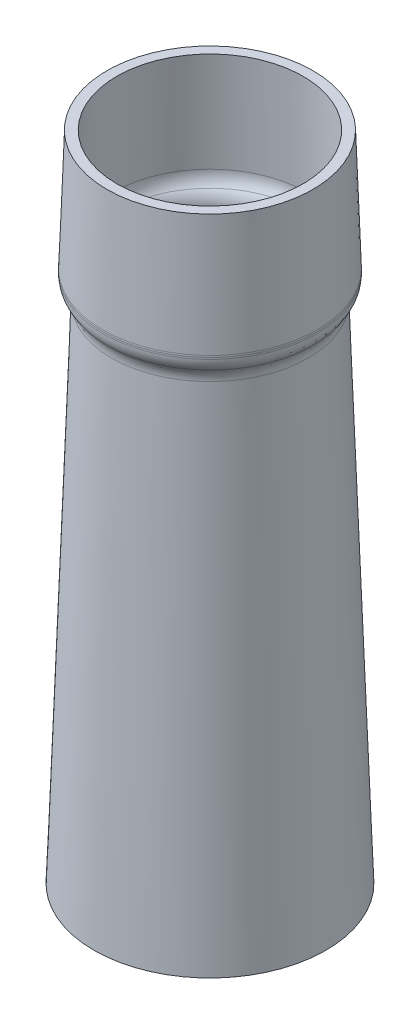
from build123d import *

# Parameters (mm, degrees)
SKETCH1_R                = 4.755
BOSS_EXTRUDE1_DEPTH      = 33.3
BOSS_EXTRUDE1_DRAFT      = 2.000000000000002
SKETCH2_R                = 4.255
CUT_EXTRUDE1_DEPTH       = 33.3
CUT_EXTRUDE1_DRAFT       = 2.000000000000002
SKETCH3_R                = 7.292967388121313
CUT_EXTRUDE2_DEPTH       = 6.2
SKETCH4_R                = 5.47150877
BOSS_EXTRUDE2_DEPTH      = 6.2
BOSS_EXTRUDE2_TAPER      = 2.000000000000002
SKETCH5_R                = 4.755000000000001
CUT_EXTRUDE3_DEPTH       = 6.2
CUT_EXTRUDE3_DRAFT       = 2.000000000000002
BOSS_EXTRUDE3_DEPTH      = 0.1
BOSS_EXTRUDE3_DEPTH_BACK = 0.5
SKETCH8_R                = 5.47150877
SKETCH8_R_2              = 4.471508770848837
FILLET3_R                = 1
FILLET4_R                = 1
FILLET5_R                = 1
FILLET6_R                = 1
FILLET7_R                = 1


with BuildPart() as part:
    # Sketch1 → Boss-Extrude1 (with draft: the straight prism first)
    with BuildSketch(Plane(origin=(0, 0, 0), x_dir=(1, 0, 0), z_dir=(0, 1, 0))):
        Circle(SKETCH1_R)
    extrude(amount=-BOSS_EXTRUDE1_DEPTH)
    # Boss-Extrude1: the draft: its side faces are tilted about the plane it starts from
    boss_extrude1_sides = [part.faces().sort_by_distance(p)[0] for p in [
        (-4.755, -16.65, 0),
    ]]
    draft(boss_extrude1_sides, Plane(origin=(0, 0, 0), x_dir=(1, 0, 0), z_dir=(0, 1, 0)), BOSS_EXTRUDE1_DRAFT)


with BuildPart() as cut_extrude1_tool:
    # Sketch2 → Cut-Extrude1 (with draft: the straight prism first)
    with BuildSketch(Plane(origin=(0, 0, 0), x_dir=(1, 0, 0), z_dir=(0, 1, 0))):
        Circle(SKETCH2_R)
    extrude(amount=-CUT_EXTRUDE1_DEPTH)
    # Cut-Extrude1: the draft: its side faces are tilted about the plane it starts from
    cut_extrude1_sides = [cut_extrude1_tool.faces().sort_by_distance(p)[0] for p in [
        (-4.255, -16.65, 0),
    ]]
    draft(cut_extrude1_sides, Plane(origin=(0, 0, 0), x_dir=(1, 0, 0), z_dir=(0, 1, 0)), CUT_EXTRUDE1_DRAFT)


with BuildPart() as part_1:
    add(part.part)

    # Cut-Extrude1: cut by cut_extrude1_tool
    add(cut_extrude1_tool.part, mode=Mode.SUBTRACT)

    # Sketch3 → Cut-Extrude2 (cut)
    with BuildSketch(Plane(origin=(0, 0, 0), x_dir=(1, 0, 0), z_dir=(0, 1, 0))):
        Circle(SKETCH3_R)
    extrude(amount=-CUT_EXTRUDE2_DEPTH, mode=Mode.SUBTRACT)

    # Sketch4 → Boss-Extrude2 (add)
    with BuildSketch(Plane(origin=(0, -6.2, 0), x_dir=(1, 0, 0), z_dir=(0, 1, 0))):
        Circle(SKETCH4_R)
    extrude(amount=BOSS_EXTRUDE2_DEPTH, taper=BOSS_EXTRUDE2_TAPER)


with BuildPart() as cut_extrude3_tool:
    # Sketch5 → Cut-Extrude3 (with draft: the straight prism first)
    with BuildSketch(Plane(origin=(0, 0, 0), x_dir=(1, 0, 0), z_dir=(0, 1, 0))):
        Circle(SKETCH5_R)
    extrude(amount=-CUT_EXTRUDE3_DEPTH)
    # Cut-Extrude3: the draft: its side faces are tilted about the plane it starts from
    cut_extrude3_sides = [cut_extrude3_tool.faces().sort_by_distance(p)[0] for p in [
        (-4.755, -3.1, 0),
    ]]
    draft(cut_extrude3_sides, Plane(origin=(0, 0, 0), x_dir=(1, 0, 0), z_dir=(0, 1, 0)), CUT_EXTRUDE3_DRAFT)


with BuildPart() as part_2:
    add(part_1.part)

    # Cut-Extrude3: cut by cut_extrude3_tool
    add(cut_extrude3_tool.part, mode=Mode.SUBTRACT)


with BuildPart() as cut_extrude3_piece_1:
    # of the separate pieces the step leaves, piece 1, a body of its own (cut_extrude3_pieces)
    add(part_2.part.solids().sort_by_distance((5.917861624, -33.3, 0))[0])



with BuildPart() as cut_extrude3_piece_2:
    # of the separate pieces the step leaves, piece 2, a body of its own (cut_extrude3_pieces)
    add(part_2.part.solids().sort_by_distance((5.47150877, -6.2, 0))[0])


with BuildPart() as cut_extrude3_piece_1_1:
    add(cut_extrude3_piece_1.part)

    add(cut_extrude3_piece_2.part)  # Boss-Extrude3 merges Cut-Extrude3 piece 2
    # Sketch8 → Boss-Extrude3 (add, two sides: drawn at the far end of the back side and taken through both)
    with BuildSketch(Plane(origin=(0, -6.2, 0), x_dir=(1, 0, 0), z_dir=(0, 1, 0)).offset(-BOSS_EXTRUDE3_DEPTH_BACK)):
        with Locations(Location((0, 0, 0), (0, 0, 270))):
            Circle(SKETCH8_R)
        with Locations(Location((0, 0, 0), (0, 0, 270))):
            Circle(SKETCH8_R_2, mode=Mode.SUBTRACT)
    extrude(amount=BOSS_EXTRUDE3_DEPTH + BOSS_EXTRUDE3_DEPTH_BACK)

    # Fillet3
    # the kernel refuses this fillet: 1 mm, written as the material it takes off along each edge
    with BuildSketch(Plane(origin=(0, -6.7, 0), x_dir=(-1.8e-16, 0, 1), z_dir=(-1, 0, -1.8e-16))) as fillet3_piece_1:
        with BuildLine():
            CenterArc((5.471508770848837, 0.18605349890898903), FILLET3_R, 180, 10.722559871321096)
            Line((4.488969155594713, 0), (4.471508770848837, 0))
            Line((4.471508770848837, 0), (4.471508770848837, 0.18605349890898903))
        make_face()
    revolve(axis=Axis((0, -6.7, 0), (0, 1, 0)), mode=Mode.SUBTRACT)

    # Fillet4
    # the kernel refuses this fillet: 1 mm, written as the material it adds along each edge
    with BuildSketch(Plane(origin=(0, -6.1000000000000005, 0), x_dir=(1, 0, 0), z_dir=(0, 0, 1))) as fillet4_piece_1:
        with BuildLine():
            CenterArc((3.9378741267887936, 0.8457151214558971), FILLET4_R, 302.2513636377463, 59.748636362253706)
            Line((4.47150877084877, 1.0658e-13), (4.482181463729969, -0.01691430242900882))
            ThreePointArc((4.482181463729969, -0.01691430242900882), (4.719762732374216, -0.01999999999999957), (4.968016693899662, -0.01999999999999957))
            Line((4.968016693899662, -0.01999999999999957), (4.988004510440043, 0.00069798993405001))
            Line((4.988004510440043, 0.00069798993405001), (4.957252770348271, 0.8813126080924478))
            Line((4.957252770348271, 0.8813126080924478), (4.937264953807889, 0.8806146181583978))
        make_face()
    revolve(axis=Axis((0, -6.1000000000000005, 0), (0, 1, 0)))

    # Fillet5
    # the kernel refuses this fillet: 1 mm, written as the material it takes off along each edge
    with BuildSketch(Plane(origin=(0, -6.1000000000000005, 0), x_dir=(-1.8e-16, 0, 1), z_dir=(-1, 0, -1.8e-16))) as fillet5_piece_1:
        with BuildLine():
            CenterArc((5.4715087708488035, -0.4380156830897022), FILLET5_R, 140.06894109758144, 39.931058902420205)
            Line((4.471508770848803, -0.4380156830897315), (4.471508770848837, 0))
            ThreePointArc((4.471508770848837, 0), (4.5960401438617255, 0.09284229423308599), (4.704691448818901, 0.20384971918314942))
        make_face()
    revolve(axis=Axis((0, -6.1000000000000005, 0), (0, 1, 0)), revolution_arc=90.00000000000001, mode=Mode.SUBTRACT)
    with BuildSketch(Plane(origin=(0, -6.1000000000000005, 0), x_dir=(1, 0, 2e-17), z_dir=(-2e-17, 0, 1))) as fillet5_piece_2:
        with BuildLine():
            CenterArc((5.4715087708488035, -0.4380156830897022), FILLET5_R, 140.06894109758142, 39.931058902420205)
            Line((4.4715087708488035, -0.4380156830897306), (4.471508770848837, 0))
            ThreePointArc((4.471508770848837, 0), (4.596040143861726, 0.09284229423308688), (4.7046914488189016, 0.20384971918314942))
        make_face()
    revolve(axis=Axis((0, -6.1000000000000005, 0), (0, 1, 0)), revolution_arc=270, mode=Mode.SUBTRACT)

    # Fillet6
    # the kernel refuses this fillet: 1 mm, written as the material it adds along each edge
    with BuildSketch(Plane(origin=(0, -6.7, 0), x_dir=(1, 0, 0), z_dir=(0, 0, 1))) as fillet6_piece_1:
        with BuildLine():
            CenterArc((6.018805247042198, -0.8369388067342642), FILLET6_R, 123.18173696935794, 58.818263030642015)
            Line((5.019414420023102, -0.8718383034367649), (4.99942660348272, -0.872536293370815))
            Line((4.99942660348272, -0.872536293370815), (4.968981339054329, -0.00069798993405001))
            Line((4.968981339054329, -0.00069798993405001), (4.98896915559471, 0.01999999999999957))
            ThreePointArc((4.98896915559471, 0.01999999999999957), (5.230238962797434, 0.01999999999999957), (5.460562840459316, 0.01673877613443953))
            Line((5.460562840459316, 0.01673877613443953), (5.471508770000157, -2.407e-13))
        make_face()
    revolve(axis=Axis((0, -6.7, 0), (0, 1, 0)))

    # Fillet7
    # the kernel refuses this fillet: 1 mm, written as the material it takes off along each edge
    with BuildSketch(Plane(origin=(0, -6.7, 0), x_dir=(-1.8e-16, 0, 1), z_dir=(-1, 0, -1.8e-16))) as fillet7_piece_1:
        with BuildLine():
            CenterArc((4.471508770000036, 0.4302918795001718), FILLET7_R, 320.68263745440794, 39.31736254559383)
            Line((5.471508770000037, 0.43029187950020287), (5.47150877, 0))
            ThreePointArc((5.47150877, 0), (5.350554662973599, -0.09300254811217279), (5.245157008521018, -0.2033234636169139))
        make_face()
    revolve(axis=Axis((0, -6.7, 0), (0, 1, 0)), revolution_arc=90.00000000000001, mode=Mode.SUBTRACT)
    with BuildSketch(Plane(origin=(0, -6.1000000000000005, 0), x_dir=(-1.8e-16, 0, 1), z_dir=(-1, 0, -1.8e-16))) as fillet7_piece_2:
        with BuildLine():
            CenterArc((4.47150877, -0.08349825924513077), FILLET7_R, 0, 4.789674454393566)
            Line((5.468016693050807, -1.78e-15), (5.47150877, 0))
            Line((5.47150877, 0), (5.47150877, -0.08349825924513077))
        make_face()
    revolve(axis=Axis((0, -6.1000000000000005, 0), (0, 1, 0)), mode=Mode.SUBTRACT)
    with BuildSketch(Plane(origin=(0, -6.7, 0), x_dir=(1, 0, 2e-17), z_dir=(-2e-17, 0, 1))) as fillet7_piece_3:
        with BuildLine():
            CenterArc((4.471508770000037, 0.43029187950017356), FILLET7_R, 320.6826374544079, 39.317362545594)
            Line((5.471508770000037, 0.4302918795002064), (5.47150877, 0))
            ThreePointArc((5.47150877, 0), (5.3505546629736, -0.0930025481121719), (5.245157008521018, -0.203323463616913))
        make_face()
    revolve(axis=Axis((0, -6.7, 0), (0, 1, 0)), revolution_arc=270, mode=Mode.SUBTRACT)


solid = cut_extrude3_piece_1_1.part
